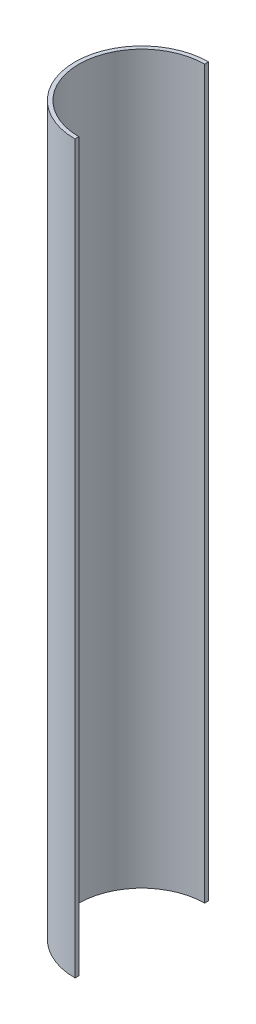
from build123d import *

# Parameters (mm, degrees)
BOSS_EXTRUDE1_DEPTH = 1174.75


with BuildPart() as part:
    # Sketch1 → Boss-Extrude1 (new body)
    with BuildSketch(Plane(origin=(0, 0, 0), x_dir=(1, 0, 0), z_dir=(0, 1, 0))):
        with BuildLine():
            Line((0, 107.95), (0, 101.6))
            ThreePointArc((0, 101.6), (-101.6, 0), (0, -101.6))
            Line((0, -101.6), (0, -107.95))
            ThreePointArc((0, -107.95), (-107.95, 0), (0, 107.95))
        make_face()
    extrude(amount=BOSS_EXTRUDE1_DEPTH)


solid = part.part
